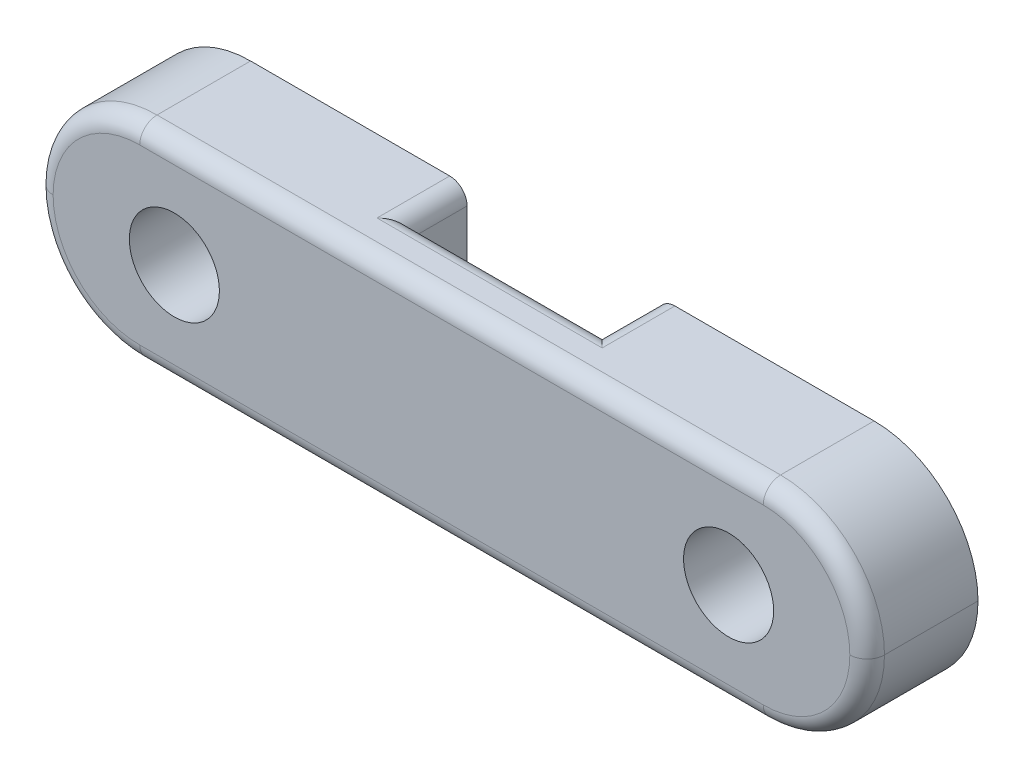
from build123d import *

# Parameters (mm, degrees)
SKETCH1_W           = 24
SKETCH1_H           = 6
SKETCH1_R           = 1.3
BOSS_EXTRUDE1_DEPTH = 3.2
SKETCH2_W           = 5.5
SKETCH2_H           = 6
CUT_EXTRUDE1_DEPTH  = 1.6
FILLET1_R           = 3
FILLET2_R           = 0.5


with BuildPart() as part:
    # Sketch1 → Boss-Extrude1 (new body)
    with BuildSketch(Plane.XY):
        Rectangle(SKETCH1_W, SKETCH1_H)
        with Locations((-8, 0)):
            Circle(SKETCH1_R, mode=Mode.SUBTRACT)
        with Locations((8, 0)):
            Circle(SKETCH1_R, mode=Mode.SUBTRACT)
    extrude(amount=BOSS_EXTRUDE1_DEPTH)

    # Sketch2 → Cut-Extrude1 (cut)
    with BuildSketch(Plane(origin=(0, 0, 0), x_dir=(-1, 0, 0), z_dir=(0, 0, -1))):
        Rectangle(SKETCH2_W, SKETCH2_H)
    extrude(amount=-CUT_EXTRUDE1_DEPTH, mode=Mode.SUBTRACT)

    # Fillet1
    fillet1_edges = [part.edges().sort_by_distance(p)[0] for p in [
        (-12, -3, 1.6),
        (-12, 3, 1.6),
        (12, -3, 1.6),
        (12, 3, 1.6),
    ]]
    fillet(fillet1_edges, radius=FILLET1_R - 0.0001)  # a hair under: the kernel refuses the full size

    # Fillet2
    fillet2_edges = [part.edges().sort_by_distance(p)[0] for p in [
        (-2.75, 3, 0.8),
        (0, -3, 1.6),
        (-2.75, -3, 0.8),
        (2.75, -3, 0.8),
        (0, 3, 1.6),
        (2.75, 3, 0.8),
        (0, -3, 3.2),
        (0, 3, 3.2),
        (11.121349633, 2.121349633, 3.2),
        (11.121349633, -2.121349633, 3.2),
        (-11.121349633, 2.121349633, 3.2),
        (-11.121349633, -2.121349633, 3.2),
    ]]
    fillet(fillet2_edges, radius=FILLET2_R)


solid = part.part
